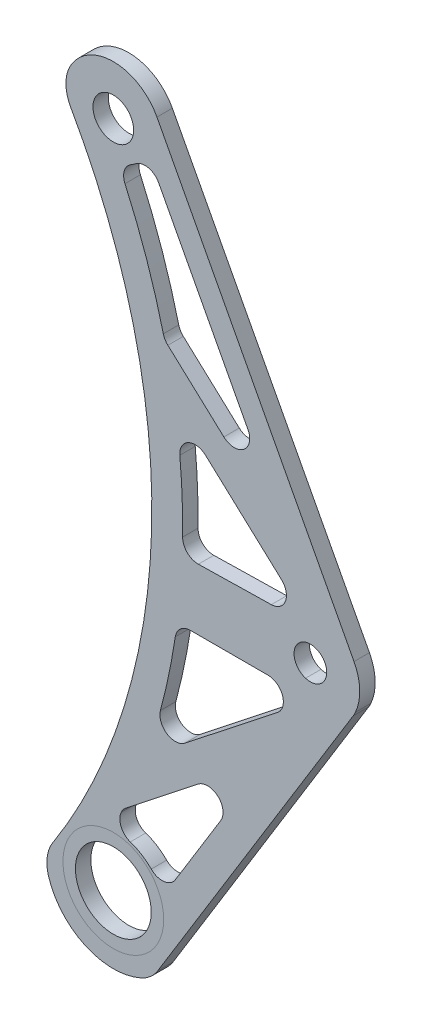
from build123d import *

# Parameters (mm, degrees)
SKETCH1_R           = 7.8105
SKETCH1_R_2         = 3.3655
SKETCH1_R_3         = 4.191
BOSS_EXTRUDE1_DEPTH = 3.175
CUT_EXTRUDE1_DEPTH  = 6.35
FILLET1_R           = 3.175
FILLET5_R           = 7.62


with BuildPart() as part:
    # Sketch1 → Boss-Extrude1 (new body)
    with BuildSketch(Plane.XY):
        with BuildLine():
            Line((8.98309661, 142.414532976), (49.565953559, 65.609056962))
            ThreePointArc((49.565953559, 65.609056962), (50.742856949, 60.862523985), (49.565953559, 56.115991009))
            Line((49.565953559, 56.115991009), (8.177790267, -11.326281223))
            ThreePointArc((8.177790267, -11.326281223), (-6.360706327, -12.437938536), (-13.97, 0))
            ThreePointArc((-13.97, 0), (7.886144716, 68.281846548), (-10.16, 137.668))
            ThreePointArc((-10.16, 137.668), (-2.445131739, 147.529385845), (8.98309661, 142.414532976))
        make_face()
        Circle(SKETCH1_R, mode=Mode.SUBTRACT)
        with Locations((40.582856949, 60.862523985)):
            Circle(SKETCH1_R_2, mode=Mode.SUBTRACT)
        with Locations((0, 137.668)):
            Circle(SKETCH1_R_3, mode=Mode.SUBTRACT)
    extrude(amount=BOSS_EXTRUDE1_DEPTH)

    # Sketch2 → Cut-Extrude1 (cut)
    with BuildSketch(Plane.XY.offset(3.175)):
        with BuildLine():
            ThreePointArc((-0.197260951, 10.983728801), (6.068963009, 9.156904403), (10.192723194, 4.097511946))
            Line((10.192723194, 4.097511946), (31.425957659, 38.69720097))
            Line((31.425957659, 38.69720097), (1.983387122, 15.513785915))
            ThreePointArc((1.983387122, 15.513785915), (0.914134712, 13.238614042), (-0.197260951, 10.983728801))
        make_face()
        with BuildLine():
            Line((6.74876061, 27.348367338), (41.023773829, 54.336902746))
            ThreePointArc((41.023773829, 54.336902746), (40.803440874, 54.325744734), (40.582856949, 54.322023985))
            Line((40.582856949, 54.322023985), (13.144472644, 54.322023985))
            ThreePointArc((13.144472644, 54.322023985), (10.640204067, 40.670739444), (6.74876061, 27.348367338))
        make_face()
        with BuildLine():
            Line((14.194143868, 66.878256842), (40.452496082, 67.401724723))
            Line((40.452496082, 67.401724723), (12.62696706, 92.949274424))
            ThreePointArc((12.62696706, 92.949274424), (14.041969258, 79.951721077), (14.194143868, 66.878256842))
        make_face()
        with BuildLine():
            Line((10.524958055, 103.49970509), (36.307285582, 79.828087082))
            Line((36.307285582, 79.828087082), (6.983478118, 135.325140768))
            ThreePointArc((6.983478118, 135.325140768), (4.680665913, 131.980353508), (0.955265361, 130.364204816))
            ThreePointArc((0.955265361, 130.364204816), (6.450850846, 117.185134994), (10.524958055, 103.49970509))
        make_face()
    extrude(amount=-CUT_EXTRUDE1_DEPTH, mode=Mode.SUBTRACT)

    # Fillet1
    fillet1_edges = [part.edges().sort_by_distance(p)[0] for p in [
        (1.983387122, 15.513785915, 1.5875),
        (-0.197260951, 10.983728801, 1.5875),
        (10.192723194, 4.097511946, 1.5875),
        (31.425957659, 38.69720097, 1.5875),
        (41.023773829, 54.336902746, 1.5875),
        (6.74876061, 27.348367338, 1.5875),
        (13.144472644, 54.322023985, 1.5875),
        (12.62696706, 92.949274424, 1.5875),
        (14.194143868, 66.878256842, 1.5875),
        (40.452496082, 67.401724723, 1.5875),
        (36.307285582, 79.828087082, 1.5875),
        (10.524958055, 103.49970509, 1.5875),
        (0.955265361, 130.364204816, 1.5875),
        (6.983478118, 135.325140768, 1.5875),
    ]]
    fillet(fillet1_edges, radius=FILLET1_R)

    # Fillet5
    # the kernel refuses this fillet: 7.62 mm, written as the material it takes off along each edge
    with BuildSketch(Plane(origin=(49.565953559, 56.115991009, -1.635210381), x_dir=(0.4384758636480836, 0.8987429649227121, 0), z_dir=(0, 0, 1))) as fillet5_piece_1:
        with BuildLine():
            CenterArc((0.408802595, 7.616051271), FILLET5_R, 264.46995043, 7.374672414)
            Line((-0.325519955, 0.031516322), (0, 0))
            ThreePointArc((0, 0), (0.327042076, -0.005264972), (0.654084152, 0))
        make_face()
    extrude(amount=6.445420761, mode=Mode.SUBTRACT)
    with BuildSketch(Plane(origin=(8.177790267, -11.326281223, -6.821790927), x_dir=(-0.8640520418582298, -0.5034024920087542, 0), z_dir=(0, 0, 1))) as fillet5_piece_2:
        with BuildLine():
            CenterArc((1.984520997, -7.583572591), FILLET5_R, 84.39536353, 33.842547752)
            Line((-1.620758554, -0.870424346), (0, 0))
            ThreePointArc((0, 0), (1.364358185, 0.066783583), (2.728716371, 0))
        make_face()
    extrude(amount=16.818581854, mode=Mode.SUBTRACT)
    with BuildSketch(Plane(origin=(-13.97, 0, -10.324988133), x_dir=(0.5491862360699723, 0.8356999928869789, 0), z_dir=(0, 0, 1))) as fillet5_piece_3:
        with BuildLine():
            CenterArc((2.785592727, -7.619579496), FILLET5_R, 90.601931521, 49.710102388)
            ThreePointArc((-3.078254062, -2.753400211), (-1.641438538, -1.262317601), (0, 0))
            ThreePointArc((0, 0), (1.352770433, -0.007105957), (2.705540865, 0))
        make_face()
    extrude(amount=23.824976265, mode=Mode.SUBTRACT)
    with BuildSketch(Plane(origin=(-10.16, 137.668, -14.214457568), x_dir=(0.2798121568434471, 0.96005476764746, 0), z_dir=(0, 0, 1))) as fillet5_piece_4:
        with BuildLine():
            CenterArc((3.553614392, -7.315617329), FILLET5_R, 73.751006034, 62.011444153)
            ThreePointArc((-1.90576169, -1.999640205), (-0.947518647, -1.004930558), (0, 0))
            ThreePointArc((0, 0), (2.842891514, 0.405843561), (5.685783027, 0))
        make_face()
    extrude(amount=31.603915135, mode=Mode.SUBTRACT)


solid = part.part
